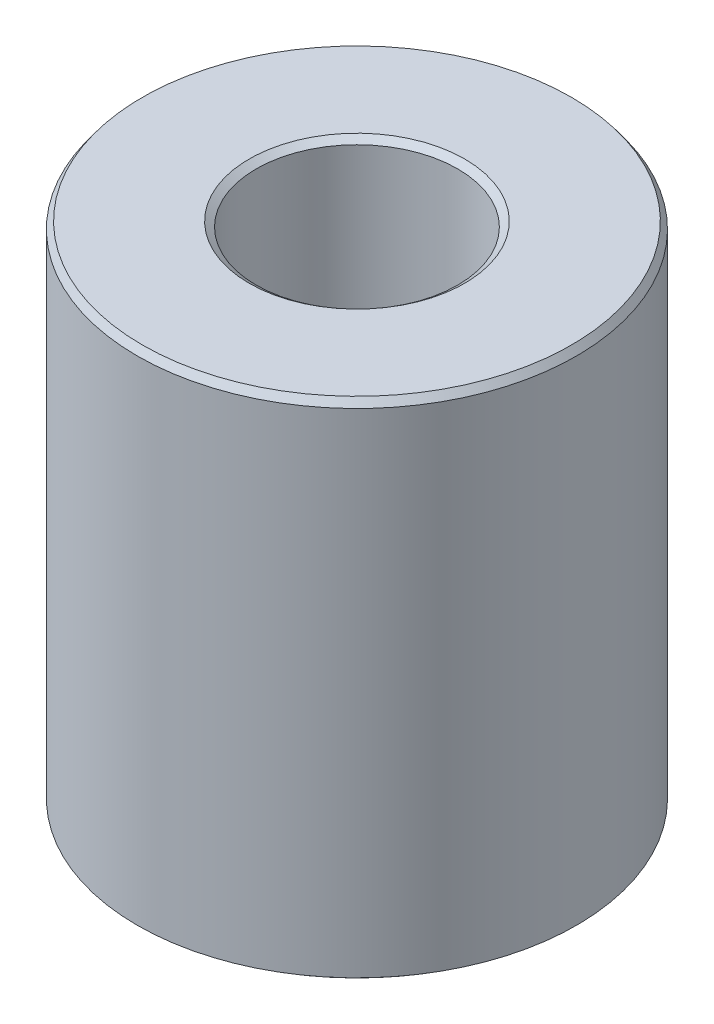
from build123d import *
from OCP.BRepFilletAPI import BRepFilletAPI_MakeChamfer

# Parameters (mm, degrees)
SKETCH1_R           = 55
BOSS_EXTRUDE1_DEPTH = 126.513965397
SKETCH2_R           = 25.230066186
CUT_EXTRUDE1_DEPTH  = 149.51189663
CHAMFER1_SIZE       = 1.752938553
CHAMFER1_SIZE2      = 1.26517148


with BuildPart() as part:
    # Sketch1 → Boss-Extrude1 (new body)
    with BuildSketch(Plane(origin=(0, 0, 0), x_dir=(1, 0, 0), z_dir=(0, 1, 0))):
        Circle(SKETCH1_R)
    extrude(amount=BOSS_EXTRUDE1_DEPTH)

    # Sketch2 → Cut-Extrude1 (cut, through all)
    with BuildSketch(Plane(origin=(0, 0, 0), x_dir=(1, 0, 0), z_dir=(0, 1, 0))):
        Circle(SKETCH2_R)
    extrude(amount=CUT_EXTRUDE1_DEPTH, mode=Mode.SUBTRACT)

    # Chamfer1: one chamfer whose edges measure the first distance from different faces: ONE call of the kernel's chamfer builder (chamfer() names one face for all edges)
    chamfer1_edges_1 = [part.edges().sort_by_distance(p)[0] for p in [
        (-25.230066186, 126.513965397, 0),
    ]]
    chamfer1_side_1 = [part.faces().sort_by_distance(p)[0] for p in [
        (-53.444365081, 126.513965397, 0),
    ]]
    chamfer1_edges_2 = [part.edges().sort_by_distance(p)[0] for p in [
        (-25.230066186, 0, 0),
    ]]
    chamfer1_side_2 = [part.faces().sort_by_distance(p)[0] for p in [
        (-25.230066186, 63.256982699, 0),
    ]]
    chamfer1_edges_3 = [part.edges().sort_by_distance(p)[0] for p in [
        (-55, 0, 0),
    ]]
    chamfer1_side_3 = [part.faces().sort_by_distance(p)[0] for p in [
        (-53.444365081, 0, 0),
    ]]
    chamfer1_edges_4 = [part.edges().sort_by_distance(p)[0] for p in [
        (-55, 126.513965397, 0),
    ]]
    chamfer1_side_4 = [part.faces().sort_by_distance(p)[0] for p in [
        (-55, 63.256982699, 0),
    ]]
    chamfer1 = BRepFilletAPI_MakeChamfer(part.part.solid().wrapped)
    for e in chamfer1_edges_1:
        chamfer1.Add(CHAMFER1_SIZE, CHAMFER1_SIZE2, e.wrapped, chamfer1_side_1[0].wrapped)  # the first distance lies on this face
    for e in chamfer1_edges_2:
        chamfer1.Add(CHAMFER1_SIZE, CHAMFER1_SIZE2, e.wrapped, chamfer1_side_2[0].wrapped)  # the first distance lies on this face
    for e in chamfer1_edges_3:
        chamfer1.Add(CHAMFER1_SIZE, CHAMFER1_SIZE2, e.wrapped, chamfer1_side_3[0].wrapped)  # the first distance lies on this face
    for e in chamfer1_edges_4:
        chamfer1.Add(CHAMFER1_SIZE, CHAMFER1_SIZE2, e.wrapped, chamfer1_side_4[0].wrapped)  # the first distance lies on this face
    add(Compound.cast(chamfer1.Shape()), mode=Mode.REPLACE)


solid = part.part
